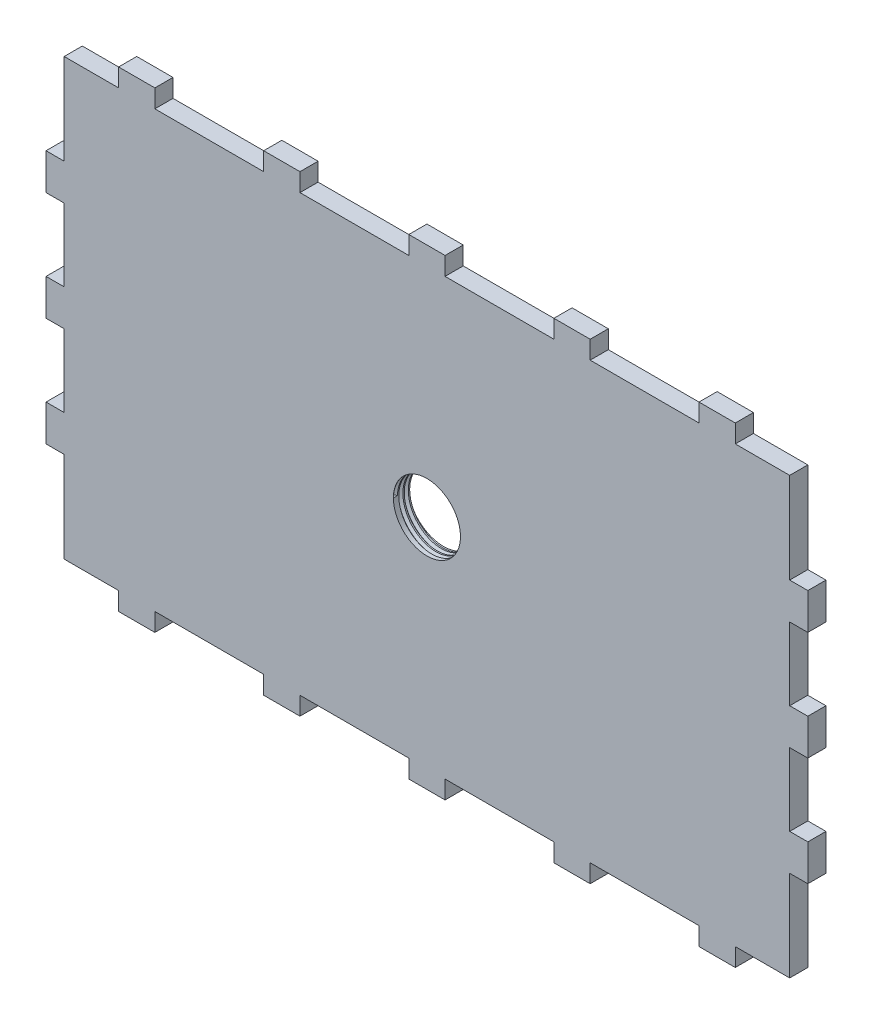
from build123d import *

# Parameters (mm, degrees)
SKETCH1_R           = 9.25
BOSS_EXTRUDE1_DEPTH = 5
THREAD1_PITCH       = 1.5


with BuildPart() as part:
    # Sketch1 → Boss-Extrude1 (new body)
    with BuildSketch(Plane.XY):
        Polygon((-85, 60), (-85, 65), (-75, 65), (-75, 60), (-45, 60), (-45, 65), (-35, 65), (-35, 60), (-5, 60), (-5, 65), (5, 65), (5, 60), (35, 60), (35, 65), (45, 65), (45, 60), (75, 60), (75, 65), (85, 65), (85, 60), (100, 60), (100, 35), (105, 35), (105, 25), (100, 25), (100, 5), (105, 5), (105, -5), (100, -5), (100, -25), (105, -25), (105, -35), (100, -35), (100, -60), (85, -60), (85, -65), (75, -65), (75, -60), (45, -60), (45, -65), (35, -65), (35, -60), (5, -60), (5, -65), (-5, -65), (-5, -60), (-35, -60), (-35, -65), (-45, -65), (-45, -60), (-75, -60), (-75, -65), (-85, -65), (-85, -60), (-100, -60), (-100, -35), (-105, -35), (-105, -25), (-100, -25), (-100, -5), (-105, -5), (-105, 5), (-100, 5), (-100, 25), (-105, 25), (-105, 35), (-100, 35), (-100, 60), align=None)
        Circle(SKETCH1_R, mode=Mode.SUBTRACT)
    extrude(amount=BOSS_EXTRUDE1_DEPTH)

    # Thread1: the profile of Thread Profile1 profile screwed along a right-hand helix of 3.333333 turns, 8 arcs to a turn; built about Z, then put on its axis
    thread1_z = Axis((0, 0, 0), (0, 0, 1))
    thread1_corners = [(9.2497, 0, -0.000173205), (10.061898813, 0, 0.468749998), (10.061898813, 0, 0.656249998), (9.2497, 0, 1.125173201)]
    with BuildLine(mode=Mode.PRIVATE) as thread1_profile:
        Line(thread1_corners[0], thread1_corners[1])
        Line(thread1_corners[1], thread1_corners[2])
        Line(thread1_corners[2], thread1_corners[3])
        Line(thread1_corners[3], thread1_corners[0])
    thread1_cap = Face(thread1_profile.wire())
    thread1_turn_angles = [0, 22.5, 45, 67.5, 90, 112.5, 135, 157.5, 180, 202.5, 225, 247.5, 270, 292.5, 315, 337.5, 360]
    thread1_turn_weights = [1, 0.9238795325112867, 1, 0.9238795325112867, 1, 0.9238795325112867, 1, 0.9238795325112867, 1, 0.9238795325112867, 1, 0.9238795325112867, 1, 0.9238795325112867, 1, 0.9238795325112867, 1]
    thread1_turn_rails = [Edge.make_bspline([Vector(p[0], p[1], 0).rotate(thread1_z, thread1_turn_angles[k]) / thread1_turn_weights[k] + Vector(0, 0, p[2] + THREAD1_PITCH * thread1_turn_angles[k] / 360) for k in range(17)], [0, 0, 0, 1, 1, 2, 2, 3, 3, 4, 4, 5, 5, 6, 6, 7, 7, 8, 8, 8], 2, thread1_turn_weights) for p in thread1_corners]
    thread1_turn_sides = [Face.make_surface_from_curves(thread1_turn_rails[p[0]], thread1_turn_rails[p[1]]) for p in [(0, 1), (1, 2), (2, 3), (3, 0)]]
    thread1_last_angles = [1080, 1102.5, 1125, 1147.5, 1170, 1185, 1200]
    thread1_last_weights = [1, 0.9238795325112867, 1, 0.9238795325112867, 1, 0.9659258262890688, 1]
    thread1_last_rails = [Edge.make_bspline([Vector(p[0], p[1], 0).rotate(thread1_z, thread1_last_angles[k]) / thread1_last_weights[k] + Vector(0, 0, p[2] + THREAD1_PITCH * thread1_last_angles[k] / 360) for k in range(7)], [0, 0, 0, 1, 1, 2, 2, 3, 3, 3], 2, thread1_last_weights) for p in thread1_corners]
    thread1_last_sides = [Face.make_surface_from_curves(thread1_last_rails[p[0]], thread1_last_rails[p[1]]) for p in [(0, 1), (1, 2), (2, 3), (3, 0)]]
    thread1 = Plane(origin=(0, 0, 5), x_dir=(-1, 0, 0), z_dir=(0, 0, -1)) * Solid(Shell([*[p.moved(Location((0, 0, THREAD1_PITCH * i))) for i in range(3) for p in thread1_turn_sides], *thread1_last_sides, thread1_cap, thread1_cap.rotate(thread1_z, 1200).moved(Location((0, 0, THREAD1_PITCH * 1200 / 360)))]))
    add(thread1, mode=Mode.SUBTRACT)


solid = part.part
